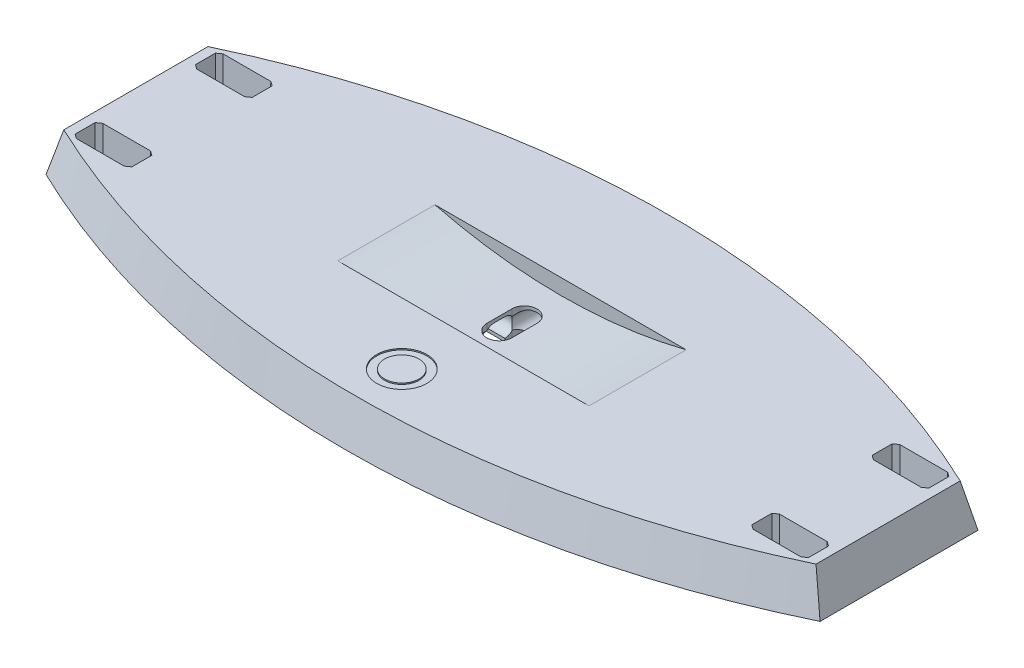
from build123d import *
from OCP.BRepFilletAPI import BRepFilletAPI_MakeChamfer

# Parameters (mm, degrees)
BOSS_EXTRU_1_DEPTH                            = 13
ESQUISSE2_R                                   = 163.15
ENL_V_MAT_EXTRU_1_DEPTH                       = 15.5
ESQUISSE3_W                                   = 18.1
ESQUISSE3_H                                   = 8.4
ENL_V_MAT_EXTRU_2_DEPTH                       = 11
ENL_V_MAT_EXTRU_2_DRAFT                       = -2
CHANFREIN1_SIZE                               = 1
CHANFREIN1_SIZE2                              = 1.430637588
SYM_TRIE2_COPY_1_SKETCH_W                     = 18.1
SYM_TRIE2_COPY_1_SKETCH_H                     = 8.4
SYM_TRIE2_COPY_1_DEPTH                        = 11
SYM_TRIE2_COPY_1_DRAFT                        = -2
CHANFREIN1_OF_SYM_TRIE2_SIZE                  = 1
CHANFREIN1_OF_SYM_TRIE2_SIZE2                 = 1.430637588
D_POUILLE1_ANGLE                              = 15
ESQUISSE5_W                                   = 44.68
ESQUISSE5_H                                   = 19.78
ENL_V_MAT_EXTRU_4_DEPTH                       = 11
ENL_V_MAT_EXTRU_5_REACH                       = 250.652
ESQUISSE6_W                                   = 9
ESQUISSE6_H                                   = 5
ESQUISSE24_W                                  = 4
ESQUISSE24_H                                  = 4
BOSS_EXTRU_3_DEPTH                            = 2
TROU_POUR_TARAUDAGE_POUR_TROU_TARAUD_M2_D     = 1.6
TROU_POUR_TARAUDAGE_POUR_TROU_TARAUD_M2_DEPTH = 2.519311505
TROU_POUR_TARAUDAGE_POUR_TROU_TARAUD_M2_TIP   = 0.480688495
ESQUISSE28_W                                  = 13
ESQUISSE28_H                                  = 8
ENL_V_MAT_EXTRU_15_DEPTH                      = 2.483339502
CONG_1_R                                      = 1
ESQUISSE11_W                                  = 15
ESQUISSE11_H                                  = 17
ENL_V_MAT_EXTRU_8_DEPTH                       = 8
ENL_V_MAT_EXTRU_6_REACH                       = 209.523
ESQUISSE7_W                                   = 9
ESQUISSE7_H                                   = 4
TROU_POUR_TARAUDAGE_POUR_TROU_TARAUD_M3_D     = 2.5
TROU_POUR_TARAUDAGE_POUR_TROU_TARAUD_M3_DEPTH = 3.248924226
TROU_POUR_TARAUDAGE_POUR_TROU_TARAUD_M3_TIP   = 0.751075774
ESQUISSE27_W                                  = 13
ESQUISSE27_H                                  = 8
ENL_V_MAT_EXTRU_14_DEPTH                      = 2.483339502
CONG_2_R                                      = 1
ENL_V_MAT_EXTRU_7_OUTLINE_W                   = 12
ENL_V_MAT_EXTRU_7_OUTLINE_H                   = 15
ENL_V_MAT_EXTRU_7_DEPTH                       = 12
ENL_V_MAT_EXTRU_7_DRAFT                       = -10
ESQUISSE19_R                                  = 8
ESQUISSE19_R_2                                = 5.5
ENL_V_MAT_EXTRU_9_DEPTH                       = 0.4
ENL_V_MAT_EXTRU_12_DEPTH                      = 11
BOSS_EXTRU_2_DEPTH                            = 1.2
ENL_V_MAT_EXTRU_3_DEPTH                       = 136.194684721
ENL_V_MAT_EXTRU_11_REACH                      = 207.318
ENL_V_MAT_EXTRU_16_REACH                      = 152.747


# Read off the part's stored shape, not the designer's step: Symétrie1, Enlèv. mat.-Extru.7
with BuildPart() as part:
    # Esquisse1 → Boss.-Extru.1 (new body)
    with BuildSketch(Plane(origin=(0, 0, 0), x_dir=(1, 0, 0), z_dir=(0, 1, 0))):
        with BuildLine():
            Line((-120, 0), (120, 0))
            Line((120, 0), (120, -23))
            ThreePointArc((120, -23), (0, -50), (-120, -23))
            Line((-120, -23), (-120, 0))
        make_face()
    extrude(amount=BOSS_EXTRU_1_DEPTH)

    # Esquisse2 → Enlèv. mat.-Extru.1 (cut)
    with BuildSketch(Plane.XY):
        with Locations((0, 171.15)):
            Circle(ESQUISSE2_R)
    extrude(amount=ENL_V_MAT_EXTRU_1_DEPTH, mode=Mode.SUBTRACT)


with BuildPart() as enl_v_mat_extru_2_tool:
    # Esquisse3 → Enlèv. mat.-Extru.2 (with draft: the straight prism first)
    with BuildSketch(Plane(origin=(0, 13, 0), x_dir=(1, 0, 0), z_dir=(0, 1, 0))):
        with Locations((-107.95, -19.2)):
            Rectangle(ESQUISSE3_W, ESQUISSE3_H)
    extrude(amount=-ENL_V_MAT_EXTRU_2_DEPTH)
    # Enlèv. mat.-Extru.2: the draft: its side faces are tilted about the plane it starts from
    enl_v_mat_extru_2_sides = [enl_v_mat_extru_2_tool.faces().sort_by_distance(p)[0] for p in [
        (-117, 7.5, 19.2),
        (-107.95, 7.5, 23.4),
        (-98.9, 7.5, 19.2),
        (-107.95, 7.5, 15),
    ]]
    draft(enl_v_mat_extru_2_sides, Plane(origin=(0, 13, 0), x_dir=(1, 0, 0), z_dir=(0, 1, 0)), ENL_V_MAT_EXTRU_2_DRAFT)


with BuildPart() as part_1:
    add(part.part)

    # Enlèv. mat.-Extru.2: cut by enl_v_mat_extru_2_tool
    add(enl_v_mat_extru_2_tool.part, mode=Mode.SUBTRACT)

    # Chanfrein1: one chamfer whose edges measure the first distance from different faces: ONE call of the kernel's chamfer builder (chamfer() names one face for all edges)
    chanfrein1_edges_1 = [part_1.edges().sort_by_distance(p)[0] for p in [
        (-116.807935768, 7.5, 23.207935768),
        (-116.807935768, 7.5, 15.192064232),
    ]]
    chanfrein1_side_1 = [part_1.faces().sort_by_distance(p)[0] for p in [
        (-116.811003737, 7.58785514, 19.2),
    ]]
    chanfrein1_edges_2 = [part_1.edges().sort_by_distance(p)[0] for p in [
        (-99.092064232, 7.5, 15.192064232),
        (-99.092064232, 7.5, 23.207935768),
    ]]
    chanfrein1_side_2 = [part_1.faces().sort_by_distance(p)[0] for p in [
        (-99.088996263, 7.58785514, 19.2),
    ]]
    chanfrein1 = BRepFilletAPI_MakeChamfer(part_1.part.solid().wrapped)
    for e in chanfrein1_edges_1:
        chanfrein1.Add(CHANFREIN1_SIZE, CHANFREIN1_SIZE2, e.wrapped, chanfrein1_side_1[0].wrapped)  # the first distance lies on this face
    for e in chanfrein1_edges_2:
        chanfrein1.Add(CHANFREIN1_SIZE, CHANFREIN1_SIZE2, e.wrapped, chanfrein1_side_2[0].wrapped)  # the first distance lies on this face
    add(Compound.cast(chanfrein1.Shape()), mode=Mode.REPLACE)


with BuildPart() as sym_trie2_copy_1_tool:
    # Symétrie2 copy 1 sketch → Symétrie2 copy 1 (with draft: the straight prism first)
    with BuildSketch(Plane(origin=(0, 13, 0), x_dir=(-1, 0, 0), z_dir=(0, 1, 0))):
        with Locations((-107.95, 19.2)):
            Rectangle(SYM_TRIE2_COPY_1_SKETCH_W, SYM_TRIE2_COPY_1_SKETCH_H)
    extrude(amount=-SYM_TRIE2_COPY_1_DEPTH)
    # Symétrie2 copy 1: the draft: its side faces are tilted about the plane it starts from
    sym_trie2_copy_1_sides = [sym_trie2_copy_1_tool.faces().sort_by_distance(p)[0] for p in [
        (117, 7.5, 19.2),
        (107.95, 7.5, 23.4),
        (98.9, 7.5, 19.2),
        (107.95, 7.5, 15),
    ]]
    draft(sym_trie2_copy_1_sides, Plane(origin=(0, 13, 0), x_dir=(-1, 0, 0), z_dir=(0, 1, 0)), SYM_TRIE2_COPY_1_DRAFT)


with BuildPart() as part_2:
    add(part_1.part)

    # Symétrie2 copy 1: cut by sym_trie2_copy_1_tool
    add(sym_trie2_copy_1_tool.part, mode=Mode.SUBTRACT)

    # Chanfrein1 of Symétrie2: one chamfer whose edges measure the first distance from different faces: ONE call of the kernel's chamfer builder (chamfer() names one face for all edges)
    chanfrein1_of_sym_trie2_edges_1 = [part_2.edges().sort_by_distance(p)[0] for p in [
        (116.807935768, 7.5, 23.207935768),
        (116.807935768, 7.5, 15.192064232),
    ]]
    chanfrein1_of_sym_trie2_side_1 = [part_2.faces().sort_by_distance(p)[0] for p in [
        (116.811003737, 7.58785514, 19.2),
    ]]
    chanfrein1_of_sym_trie2_edges_2 = [part_2.edges().sort_by_distance(p)[0] for p in [
        (99.092064232, 7.5, 15.192064232),
        (99.092064232, 7.5, 23.207935768),
    ]]
    chanfrein1_of_sym_trie2_side_2 = [part_2.faces().sort_by_distance(p)[0] for p in [
        (99.088996263, 7.58785514, 19.2),
    ]]
    chanfrein1_of_sym_trie2 = BRepFilletAPI_MakeChamfer(part_2.part.solid().wrapped)
    for e in chanfrein1_of_sym_trie2_edges_1:
        chanfrein1_of_sym_trie2.Add(CHANFREIN1_OF_SYM_TRIE2_SIZE, CHANFREIN1_OF_SYM_TRIE2_SIZE2, e.wrapped, chanfrein1_of_sym_trie2_side_1[0].wrapped)  # the first distance lies on this face
    for e in chanfrein1_of_sym_trie2_edges_2:
        chanfrein1_of_sym_trie2.Add(CHANFREIN1_OF_SYM_TRIE2_SIZE, CHANFREIN1_OF_SYM_TRIE2_SIZE2, e.wrapped, chanfrein1_of_sym_trie2_side_2[0].wrapped)  # the first distance lies on this face
    add(Compound.cast(chanfrein1_of_sym_trie2.Shape()), mode=Mode.REPLACE)

    # Symétrie1: part across plane


with BuildPart() as part_3:
    add(part_2.part)
    add(part_2.part.mirror(Plane.XY))

    # Dépouille1
    d_pouille1_faces = [part_3.faces().sort_by_distance(p)[0] for p in [
        (120, 6.5, 0),
        (0, 6.5, -50),
        (0, 6.5, 50),
        (-120, 6.5, 0),
    ]]
    draft(d_pouille1_faces, Plane(origin=(0, 13, -230.166666667), x_dir=(0, 0, 1), z_dir=(0, 1, 0)), D_POUILLE1_ANGLE)

    # Esquisse5 → Enlèv. mat.-Extru.4 (cut)
    with BuildSketch(Plane.XZ):
        with Locations((-96.66, 0)):
            Rectangle(ESQUISSE5_W, ESQUISSE5_H)
    extrude(amount=-ENL_V_MAT_EXTRU_4_DEPTH, mode=Mode.SUBTRACT)

    # Enlèv. mat.-Extru.5: up to this plane
    enl_v_mat_extru_5_end = Plane(origin=(-120, 13, 0), z_dir=(-0.9659258262890681, 0.25881904510252135, 0))
    # Esquisse6 → Enlèv. mat.-Extru.5 (cut, up to the surface)
    with BuildSketch(Plane(origin=(-119, 0, 0), x_dir=(0, 0, -1), z_dir=(1, 0, 0)), mode=Mode.PRIVATE) as enl_v_mat_extru_5_sk1:
        with Locations((0, 5.5)):
            Rectangle(ESQUISSE6_W, ESQUISSE6_H)
    enl_v_mat_extru_5_tool1 = split(extrude(enl_v_mat_extru_5_sk1.sketch, amount=-ENL_V_MAT_EXTRU_5_REACH, mode=Mode.PRIVATE), bisect_by=enl_v_mat_extru_5_end, keep=Keep.BOTH, mode=Mode.PRIVATE)
    add(enl_v_mat_extru_5_tool1.solids().sort_by_distance((-119, 5.5, 0))[0], mode=Mode.SUBTRACT)

    # Esquisse24 → Boss.-Extru.3 (add)
    with BuildSketch(Plane.XZ.offset(-11)):
        with Locations((-117, 7.89)):
            Rectangle(ESQUISSE24_W, ESQUISSE24_H)
        with Locations((-117, -7.89)):
            Rectangle(ESQUISSE24_W, ESQUISSE24_H)
        with Locations((-76.32, 7.89)):
            Rectangle(ESQUISSE24_W, ESQUISSE24_H)
        with Locations((-76.32, -7.89)):
            Rectangle(ESQUISSE24_W, ESQUISSE24_H)
    extrude(amount=BOSS_EXTRU_3_DEPTH)

    # Trou pour taraudage pour trou taraudé M21
    with Locations(Plane(origin=(0, 9, 0), x_dir=(-1, 0, 0), z_dir=(0, -1, 0))):
        with Locations((117.5, -7.62), (76.86, 7.62), (117.5, 7.62), (76.86, -7.62)):
            Hole(TROU_POUR_TARAUDAGE_POUR_TROU_TARAUD_M2_D / 2, depth=TROU_POUR_TARAUDAGE_POUR_TROU_TARAUD_M2_DEPTH)
            with Locations((0, 0, -(TROU_POUR_TARAUDAGE_POUR_TROU_TARAUD_M2_DEPTH + TROU_POUR_TARAUDAGE_POUR_TROU_TARAUD_M2_TIP / 2))):  # 118° drill point
                Cone(0, TROU_POUR_TARAUDAGE_POUR_TROU_TARAUD_M2_D / 2, TROU_POUR_TARAUDAGE_POUR_TROU_TARAUD_M2_TIP, mode=Mode.SUBTRACT)

    # Esquisse28 → Enlèv. mat.-Extru.15 (cut)
    with BuildSketch(Plane(origin=(-123.483339502, 0, 0), x_dir=(0, 0, -1), z_dir=(1, 0, 0))):
        with Locations((0, 5.5)):
            Rectangle(ESQUISSE28_W, ESQUISSE28_H)
    extrude(amount=ENL_V_MAT_EXTRU_15_DEPTH, mode=Mode.SUBTRACT)

    # Congé1
    cong_1_edges = [part_3.edges().sort_by_distance(p)[0] for p in [
        (-115, 10, 5.89),
        (-115, 10, -5.89),
        (-78.32, 10, 5.89),
        (-78.32, 10, -5.89),
        (-120, 8, -4.5),
        (-120, 8, 4.5),
        (-120, 3, 4.5),
        (-120, 3, -4.5),
        (-122.040707856, 1.5, -6.5),
        (-122.040707856, 1.5, 6.5),
    ]]
    fillet(cong_1_edges, radius=CONG_1_R)

    # Esquisse11 → Enlèv. mat.-Extru.8 (cut)
    with BuildSketch(Plane.XZ):
        with Locations((0, -40.5)):
            Rectangle(ESQUISSE11_W, ESQUISSE11_H)
    extrude(amount=-ENL_V_MAT_EXTRU_8_DEPTH, mode=Mode.SUBTRACT)

    # Enlèv. mat.-Extru.6: up to this cone (the profile starts inside it)
    enl_v_mat_extru_6_end = Plane(origin=(0, 4.8, 230.166666667), z_dir=(0, -1, 0)) * Cone(150.429191211, 414.298508878, 984.773700089, mode=Mode.PRIVATE)
    # Esquisse7 → Enlèv. mat.-Extru.6 (cut, up to the surface)
    with BuildSketch(Plane(origin=(56.5, 0, -49), x_dir=(1, 0, 0), z_dir=(0, 0, 1)), mode=Mode.PRIVATE) as enl_v_mat_extru_6_sk1:
        with Locations((-56.5, 4.8)):
            Rectangle(ESQUISSE7_W, ESQUISSE7_H)
    enl_v_mat_extru_6_tool1 = extrude(enl_v_mat_extru_6_sk1.sketch, amount=-ENL_V_MAT_EXTRU_6_REACH, mode=Mode.PRIVATE) & enl_v_mat_extru_6_end
    add(enl_v_mat_extru_6_tool1.solids().sort_by_distance((0, 4.8, -49))[0], mode=Mode.SUBTRACT)

    # Trou pour taraudage pour trou taraudé M31
    with Locations(Plane(origin=(0, 8, 0), x_dir=(-1, 0, 0), z_dir=(0, -1, 0))):
        with Locations((-4.5, 39.7), (4.5, 39.7)):
            Hole(TROU_POUR_TARAUDAGE_POUR_TROU_TARAUD_M3_D / 2, depth=TROU_POUR_TARAUDAGE_POUR_TROU_TARAUD_M3_DEPTH)
            with Locations((0, 0, -(TROU_POUR_TARAUDAGE_POUR_TROU_TARAUD_M3_DEPTH + TROU_POUR_TARAUDAGE_POUR_TROU_TARAUD_M3_TIP / 2))):  # 118° drill point
                Cone(0, TROU_POUR_TARAUDAGE_POUR_TROU_TARAUD_M3_D / 2, TROU_POUR_TARAUDAGE_POUR_TROU_TARAUD_M3_TIP, mode=Mode.SUBTRACT)

    # Esquisse27 → Enlèv. mat.-Extru.14 (cut)
    with BuildSketch(Plane.XY.offset(-53.483339502)):
        with Locations((0, 4.8)):
            Rectangle(ESQUISSE27_W, ESQUISSE27_H)
    extrude(amount=ENL_V_MAT_EXTRU_14_DEPTH, mode=Mode.SUBTRACT)

    # Congé2
    cong_2_edges = [part_3.edges().sort_by_distance(p)[0] for p in [
        (-4.5, 6.8, -50),
        (4.5, 6.8, -50),
        (4.5, 2.8, -50),
        (-4.5, 2.8, -50),
        (-6.5, 8.8, -51.025138349),
        (6.5, 8.8, -51.025138349),
        (-6.5, 0.8, -52.097219218),
        (6.5, 0.8, -52.097219218),
    ]]
    fillet(cong_2_edges, radius=CONG_2_R)


with BuildPart() as enl_v_mat_extru_7_tool:
    # Enlèv. mat.-Extru.7 outline → Enlèv. mat.-Extru.7 (with draft: the straight prism first)
    with BuildSketch(Plane.XZ.offset(-12)):
        with Locations((0, 33.662754995)):
            Rectangle(ENL_V_MAT_EXTRU_7_OUTLINE_W, ENL_V_MAT_EXTRU_7_OUTLINE_H)
    extrude(amount=ENL_V_MAT_EXTRU_7_DEPTH)
    # Enlèv. mat.-Extru.7: the draft: its side faces are tilted about the plane it starts from
    enl_v_mat_extru_7_sides = [enl_v_mat_extru_7_tool.faces().sort_by_distance(p)[0] for p in [
        (6, 6, 33.662754995),
        (0, 6, 41.162754995),
        (-6, 6, 33.662754995),
        (0, 6, 26.162754995),
    ]]
    draft(enl_v_mat_extru_7_sides, Plane.XZ.offset(-12), ENL_V_MAT_EXTRU_7_DRAFT)


with BuildPart() as part_4:
    add(part_3.part)

    # Enlèv. mat.-Extru.7: cut by enl_v_mat_extru_7_tool
    add(enl_v_mat_extru_7_tool.part, mode=Mode.SUBTRACT)

    # Esquisse19 → Enlèv. mat.-Extru.9 (cut)
    with BuildSketch(Plane(origin=(0, 13, 0), x_dir=(1, 0, 0), z_dir=(0, 1, 0))):
        with Locations(Location((0, -35.162754995, 0), (0, 0, 270))):
            Circle(ESQUISSE19_R)
        with Locations(Location((0, -35.162754995, 0), (0, 0, 270))):
            Circle(ESQUISSE19_R_2, mode=Mode.SUBTRACT)
    extrude(amount=-ENL_V_MAT_EXTRU_9_DEPTH, mode=Mode.SUBTRACT)

    # Esquisse22 → Enlèv. mat.-Extru.12 (cut)
    with BuildSketch(Plane.XZ):
        with BuildLine():
            Line((63.483339502, -4), (63.483339502, 4))
            add(Edge.make_bspline(
                [(63.483339502, 4), (74.015607722, 5.433006023), (91.364532035, 12.5), (100.983339502, 12.5)],
                knots=[0, 0, 0, 0, 1, 1, 1, 1], degree=3))
            ThreePointArc((100.983339502, 12.5), (113.483339502, 0), (100.983339502, -12.5))
            add(Edge.make_bspline(
                [(63.483339502, -4), (74.216316154, -5.285708265), (91.364532035, -12.5), (100.983339502, -12.5)],
                knots=[0, 0, 0, 0, 1, 1, 1, 1], degree=3))
        make_face()
    extrude(amount=-ENL_V_MAT_EXTRU_12_DEPTH, mode=Mode.SUBTRACT)

    # Esquisse23 → Boss.-Extru.2 (add)
    with BuildSketch(Plane.XZ):
        with BuildLine():
            Line((100.983339502, 12.5), (100.983339502, -12.5))
            ThreePointArc((100.983339502, -12.5), (113.483339502, 0), (100.983339502, 12.5))
        make_face()
    extrude(amount=-BOSS_EXTRU_2_DEPTH)

    # Esquisse4 → Enlèv. mat.-Extru.3 (cut, through all)
    with BuildSketch(Plane(origin=(0, 13, 0), x_dir=(1, 0, 0), z_dir=(0, 1, 0))):
        with BuildLine():
            Line((4, 4), (4, -4))
            ThreePointArc((4, -4), (0, -8), (-4, -4))
            Line((-4, -4), (-4, 4))
            ThreePointArc((-4, 4), (0, 8), (4, 4))
        make_face()
    extrude(amount=-ENL_V_MAT_EXTRU_3_DEPTH, mode=Mode.SUBTRACT)

    # Enlèv. mat.-Extru.11: up to this face of the body (flat: up to its plane)
    enl_v_mat_extru_11_end = Plane(part_4.part.faces().sort_by_distance((63.483339502, 5.5, 0))[0])
    # Esquisse21 → Enlèv. mat.-Extru.11 (cut, up to the picked face)
    with BuildSketch(Plane.ZY.offset(74.32), mode=Mode.PRIVATE) as enl_v_mat_extru_11_sk1:
        with BuildLine():
            Line((1.75, 0), (-1.75, 0))
            Line((-1.75, 0), (-1.75, 1))
            ThreePointArc((-1.75, 1), (-4.75, 4), (-1.75, 7))
            Line((-1.75, 7), (1.75, 7))
            ThreePointArc((1.75, 7), (4.75, 4), (1.75, 1))
            Line((1.75, 1), (1.75, 0))
        make_face()
    enl_v_mat_extru_11_tool1 = split(extrude(enl_v_mat_extru_11_sk1.sketch, amount=-ENL_V_MAT_EXTRU_11_REACH, mode=Mode.PRIVATE), bisect_by=enl_v_mat_extru_11_end, keep=Keep.BOTH, mode=Mode.PRIVATE)
    add(enl_v_mat_extru_11_tool1.solids().sort_by(Axis((-74.32, 3.76788, 0), (1, 0, 0)))[0], mode=Mode.SUBTRACT)

    # Enlèv. mat.-Extru.16: up to this plane
    enl_v_mat_extru_16_end = Plane(origin=(-6, 12, 26.162754995), z_dir=(0, 0.17364817766693072, -0.984807753012208))
    # Esquisse29 → Enlèv. mat.-Extru.16 (cut, up to the surface)
    with BuildSketch(Plane.XY.offset(-32), mode=Mode.PRIVATE) as enl_v_mat_extru_16_sk1:
        with BuildLine():
            Line((1.75, 0), (-1.75, 0))
            Line((-1.75, 0), (-1.75, 1))
            ThreePointArc((-1.75, 1), (-4.75, 4), (-1.75, 7))
            Line((-1.75, 7), (1.75, 7))
            ThreePointArc((1.75, 7), (4.75, 4), (1.75, 1))
            Line((1.75, 1), (1.75, 0))
        make_face()
    enl_v_mat_extru_16_tool1 = split(extrude(enl_v_mat_extru_16_sk1.sketch, amount=ENL_V_MAT_EXTRU_16_REACH, mode=Mode.PRIVATE), bisect_by=enl_v_mat_extru_16_end, keep=Keep.BOTH, mode=Mode.PRIVATE)
    add(enl_v_mat_extru_16_tool1.solids().sort_by_distance((0, 3.76788, -32))[0], mode=Mode.SUBTRACT)


solid = part_4.part
